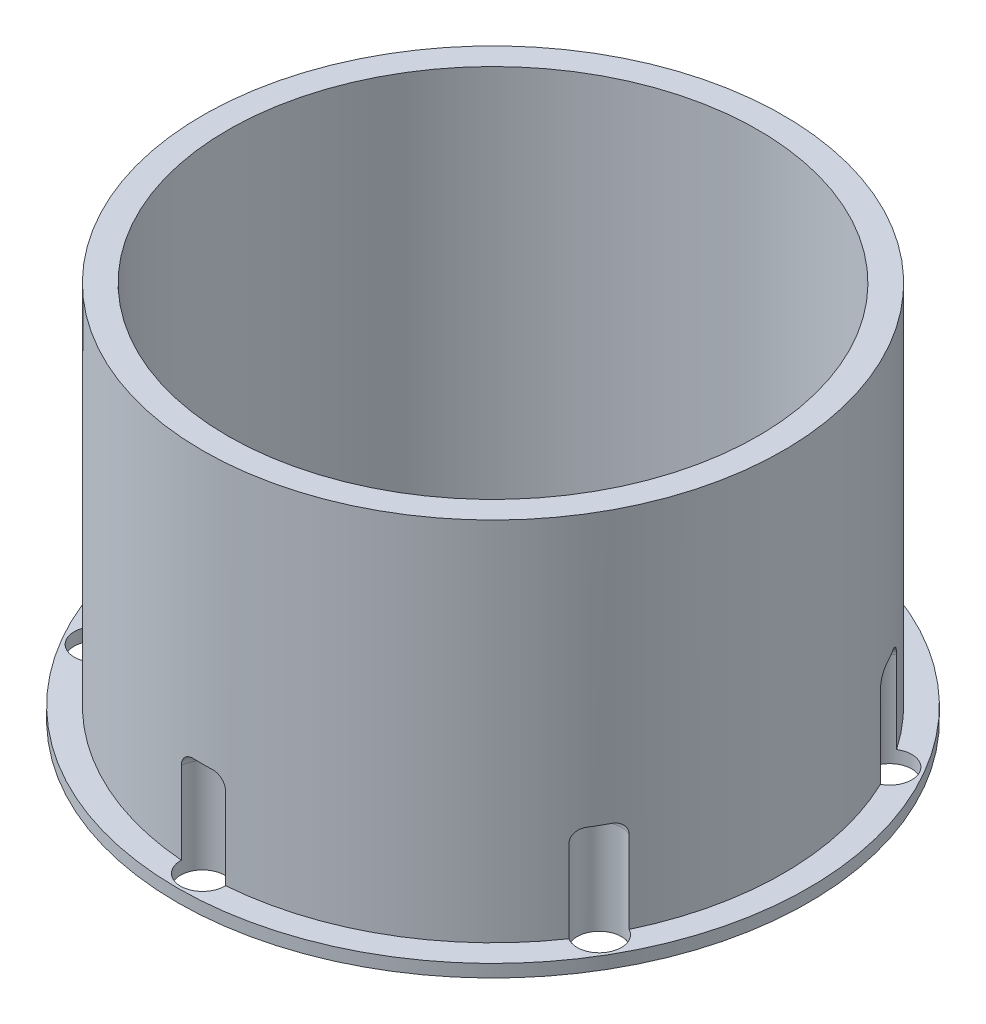
from build123d import *

# Parameters (mm, degrees)
SKETCH4_R                = 63.5
SKETCH4_R_2              = 53.34
BOSS_EXTRUDE1_DEPTH      = 2.54
SKETCH6_R                = 4.445
CUT_EXTRUDE2_DEPTH       = 2.54
CIRPATTERN1_COUNT        = 6
SKETCH9_R                = 58.42
SKETCH9_R_2              = 53.34
BOSS_EXTRUDE2_DEPTH      = 73.66
CUT_EXTRUDE3_START       = 19.05
SKETCH6_2_R              = 4.445
CUT_EXTRUDE3_DEPTH       = 19.05
FILLET1_R                = 2.54
CIRPATTERN3_COUNT        = 6
FILLET1_OF_CIRPATTERN3_R = 2.54


with BuildPart() as part:
    # Sketch4 → Boss-Extrude1 (new body)
    with BuildSketch(Plane(origin=(0, 0, 0), x_dir=(1, 0, 0), z_dir=(0, 1, 0))):
        Circle(SKETCH4_R)
        Circle(SKETCH4_R_2, mode=Mode.SUBTRACT)
    extrude(amount=BOSS_EXTRUDE1_DEPTH)

    # Sketch6 → Cut-Extrude2 (cut)
    with BuildSketch(Plane(origin=(0, 2.54, 0), x_dir=(1, 0, 0), z_dir=(0, 1, 0))):
        with Locations((0, -58.42)):
            Circle(SKETCH6_R)
    cut_extrude2 = extrude(amount=-CUT_EXTRUDE2_DEPTH, mode=Mode.SUBTRACT)

    # CirPattern1: Cut-Extrude2 ×6 about axis
    cirpattern1_axis = Axis((0, 2.54, 0), (0, 1, 0))
    for i in range(1, CIRPATTERN1_COUNT):
        add(cut_extrude2.rotate(cirpattern1_axis, i * 360 / CIRPATTERN1_COUNT), mode=Mode.SUBTRACT)

    # Sketch9 → Boss-Extrude2 (add)
    with BuildSketch(Plane(origin=(0, 2.54, 0), x_dir=(1, 0, 0), z_dir=(0, 1, 0))):
        Circle(SKETCH9_R)
        Circle(SKETCH9_R_2, mode=Mode.SUBTRACT)
    extrude(amount=BOSS_EXTRUDE2_DEPTH)

    # Sketch6<2> → Cut-Extrude3 (cut)
    with BuildSketch(Plane(origin=(0, 2.54, 0), x_dir=(1, 0, 0), z_dir=(0, 1, 0)).offset(CUT_EXTRUDE3_START)):
        with Locations((0, -58.42)):
            Circle(SKETCH6_2_R)
    cut_extrude3 = extrude(amount=-CUT_EXTRUDE3_DEPTH, mode=Mode.SUBTRACT)

    # Fillet1
    fillet1_edges = [part.edges().sort_by_distance(p)[0] for p in [
        (0, 21.59, 53.975),
    ]]
    fillet(fillet1_edges, radius=FILLET1_R)

    # CirPattern3: Cut-Extrude3 ×6 about axis
    cirpattern3_axis = Axis((0, 76.2, 0), (0, -1, 0))
    for i in range(1, CIRPATTERN3_COUNT):
        add(cut_extrude3.rotate(cirpattern3_axis, i * 360 / CIRPATTERN3_COUNT), mode=Mode.SUBTRACT)

    # Fillet1 of CirPattern3
    fillet1_of_cirpattern3_edges = [part.edges().sort_by_distance(p)[0] for p in [
        (-46.743721169, 21.59, 26.9875),
        (-46.743721169, 21.59, -26.9875),
        (0, 21.59, -53.975),
        (46.743721169, 21.59, -26.9875),
        (46.743721169, 21.59, 26.9875),
    ]]
    fillet(fillet1_of_cirpattern3_edges, radius=FILLET1_OF_CIRPATTERN3_R)


solid = part.part
